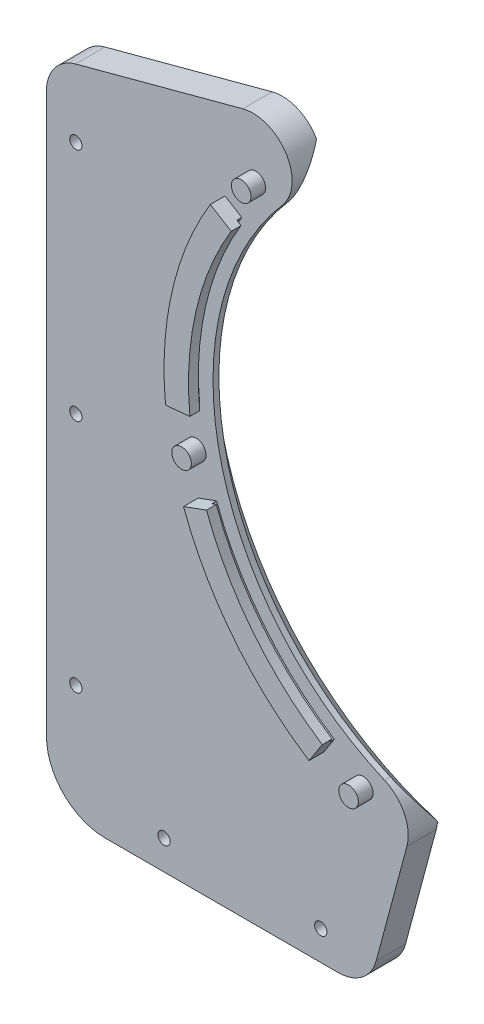
from build123d import *

# Parameters (mm, degrees)
SKETCH1_R             = 3.175
BOSS_EXTRUDE1_DEPTH   = 4.7625
BOSS_EXTRUDE1_2_DEPTH = 4.7625
BOSS_EXTRUDE1_3_DEPTH = 4.7625
BOSS_EXTRUDE1_4_DEPTH = 4.7625
BOSS_EXTRUDE1_5_DEPTH = 4.7625
SKETCH2_R             = 1.984375
BOSS_EXTRUDE2_DEPTH   = 9.525
BOSS_EXTRUDE3_DEPTH   = 3.175
CHAMFER1_SIZE         = 9.081162376
CHAMFER1_SIZE_2       = 7.62


with BuildPart() as part:
    # Sketch1 → Boss-Extrude1 (new body)
    with BuildSketch(Plane.XY):
        with Locations(Location((-78.19292114, 62.356773808, 0), (0, 0, 180))):
            Circle(SKETCH1_R)
    extrude(amount=BOSS_EXTRUDE1_DEPTH)



with BuildPart() as body_2:
    # Sketch1 → Boss-Extrude1 2 (new body)
    with BuildSketch(Plane.XY):
        with Locations(Location((-97.504977817, -22.254874907, 0), (0, 0, 180))):
            Circle(SKETCH1_R)
    extrude(amount=BOSS_EXTRUDE1_2_DEPTH)


with BuildPart() as body_3:
    # Sketch1 → Boss-Extrude1 3 (new body)
    with BuildSketch(Plane.XY):
        with Locations(Location((-43.393797458, -90.108148901, 0), (0, 0, 180))):
            Circle(SKETCH1_R)
    extrude(amount=BOSS_EXTRUDE1_3_DEPTH)


with BuildPart() as body_4:
    # Sketch1 → Boss-Extrude1 4 (new body)
    with BuildSketch(Plane.XY):
        with BuildLine():
            Line((-88.191845565, 53.571060584), (-82.764655069, 50.274379933))
            ThreePointArc((-82.764655069, 50.274379933), (-94.409581696, 21.548370942), (-96.381613527, -9.385413164))
            Line((-96.381613527, -9.385413164), (-102.701719332, -10.000850093))
            ThreePointArc((-102.701719332, -10.000850093), (-100.600373938, 22.961378873), (-88.191845565, 53.571060584))
        make_face()
    extrude(amount=BOSS_EXTRUDE1_4_DEPTH)


with BuildPart() as body_5:
    # Sketch1 → Boss-Extrude1 5 (new body)
    with BuildSketch(Plane.XY):
        with BuildLine():
            Line((-90.909011383, -33.362449786), (-96.870258031, -35.550151411))
            ThreePointArc((-96.870258031, -35.550151411), (-80.675236097, -64.336353929), (-56.214495182, -86.53086552))
            Line((-56.214495182, -86.53086552), (-52.755141633, -81.20588918))
            ThreePointArc((-52.755141633, -81.20588918), (-75.710606183, -60.377193687), (-90.909011383, -33.362449786))
        make_face()
    extrude(amount=BOSS_EXTRUDE1_5_DEPTH)


with BuildPart() as part_1:
    add(part.part)

    add(body_2.part)  # Boss-Extrude2 merges body 2

    add(body_3.part)  # Boss-Extrude2 merges body 3
    # Sketch2 → Boss-Extrude2 (add)
    with BuildSketch(Plane.XY):
        with BuildLine():
            Line((-82.430084054, 80.927094637), (-136.637001873, 66.402394783))
            ThreePointArc((-136.637001873, 66.402394783), (-143.425587422, 61.866406938), (-146.05, 54.13513679))
            Line((-146.05, 54.13513679), (-146.05, -127))
            ThreePointArc((-146.05, -127), (-140.470384182, -140.470384182), (-127, -146.05))
            Line((-127, -146.05), (-51.469574148, -146.05))
            ThreePointArc((-51.469574148, -146.05), (-43.738303999, -143.425587422), (-39.202316154, -136.637001873))
            Line((-39.202316154, -136.637001873), (-29.247808511, -99.486273586))
            ThreePointArc((-29.247808511, -99.486273586), (-30.083781104, -90.666124862), (-36.482937232, -84.53875393))
            ThreePointArc((-36.482937232, -84.53875393), (-89.766487514, -20.488614994), (-69.549981311, 60.337432202))
            ThreePointArc((-69.549981311, 60.337432202), (-68.376222335, 75.395171012), (-82.430084054, 80.927094637))
        make_face()
        with Locations((-136.525, 44.45)):
            Circle(SKETCH2_R, mode=Mode.SUBTRACT)
        with Locations((-136.525, -31.75)):
            Circle(SKETCH2_R, mode=Mode.SUBTRACT)
        with Locations((-136.525, -107.95)):
            Circle(SKETCH2_R, mode=Mode.SUBTRACT)
        with Locations((-57.15, -136.525)):
            Circle(SKETCH2_R, mode=Mode.SUBTRACT)
        with Locations((-107.95, -136.525)):
            Circle(SKETCH2_R, mode=Mode.SUBTRACT)
    extrude(amount=-BOSS_EXTRUDE2_DEPTH)


    add(body_4.part)  # Boss-Extrude3 merges body 4

    add(body_5.part)  # Boss-Extrude3 merges body 5
    # Sketch3 → Boss-Extrude3 (add)
    with BuildSketch(Plane.XY.offset(4.7625)):
        with BuildLine():
            Line((-81.407857445, 49.45020977), (-88.191845565, 53.571060584))
            ThreePointArc((-88.191845565, 53.571060584), (-100.600373938, 22.961378873), (-102.701719332, -10.000850093))
            Line((-102.701719332, -10.000850093), (-94.801587075, -9.231553932))
            ThreePointArc((-94.801587075, -9.231553932), (-92.861883635, 21.195118959), (-81.407857445, 49.45020977))
        make_face()
        with BuildLine():
            Line((-96.870258031, -35.550151411), (-89.418699721, -32.815524379))
            ThreePointArc((-89.418699721, -32.815524379), (-74.469448705, -59.387403627), (-51.890303245, -79.874645095))
            Line((-51.890303245, -79.874645095), (-56.214495182, -86.53086552))
            ThreePointArc((-56.214495182, -86.53086552), (-80.675236097, -64.336353929), (-96.870258031, -35.550151411))
        make_face()
    extrude(amount=-BOSS_EXTRUDE3_DEPTH)

    # Chamfer1
    # the kernel refuses this chamfer: 9.081162376, 7.62 mm, written as the material it takes off along each edge
    with BuildSketch(Plane(origin=(0, 0, -9.525), x_dir=(-0.15246082974719, -0.9883095139645264, 0), z_dir=(0.9883095139645264, -0.15246082974719, 0))) as chamfer1_piece_1:
        Polygon((92.075 + CHAMFER1_SIZE, 0), (92.075, -CHAMFER1_SIZE_2), (92.075, 0), align=None)
    revolve(axis=Axis((0, 0, -9.525), (0, 0, -1)), revolution_arc=136.746589735, mode=Mode.SUBTRACT)


solid = part_1.part
